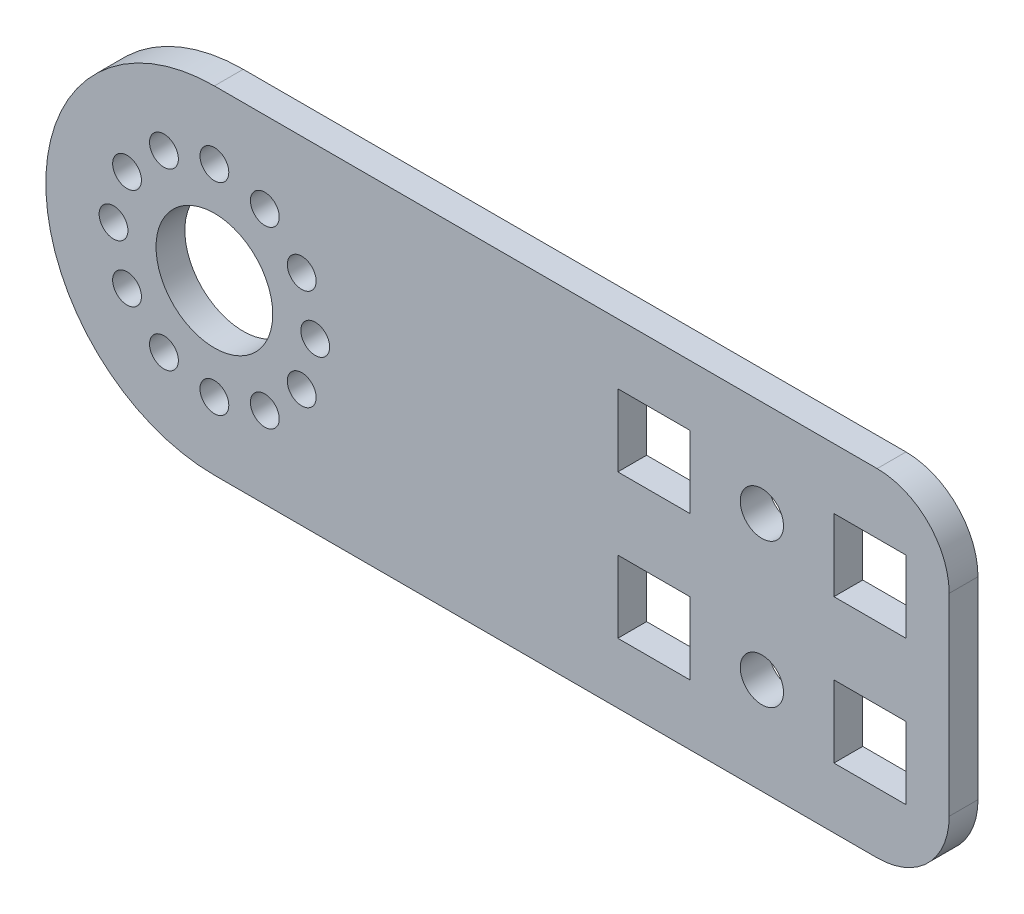
from build123d import *

# Parameters (mm, degrees)
BOSS_EXTRUDE1_OUTLINE_R   = 1
BOSS_EXTRUDE1_OUTLINE_W   = 5
BOSS_EXTRUDE1_OUTLINE_H   = 5
BOSS_EXTRUDE1_OUTLINE_R_2 = 1.5
BOSS_EXTRUDE1_OUTLINE_R_3 = 4.05
BOSS_EXTRUDE1_DEPTH       = 2
CONG_1_R                  = 5


# Read off the part's stored shape, not the designer's step: Boss-Extrude1
with BuildPart() as part:
    # Boss-Extrude1 outline → Boss-Extrude1 (new body)
    with BuildSketch(Plane.XY):
        with BuildLine():
            Line((51, -11.7), (51, 11.7))
            Line((51, 11.7), (0, 11.7))
            ThreePointArc((0, 11.7), (-11.7, 0), (0, -11.7))
            Line((0, -11.7), (51, -11.7))
        make_face()
        with Locations((0, -7)):
            Circle(BOSS_EXTRUDE1_OUTLINE_R, mode=Mode.SUBTRACT)
        with Locations((-3.5, -6.062177826)):
            Circle(BOSS_EXTRUDE1_OUTLINE_R, mode=Mode.SUBTRACT)
        with Locations((3.5, -6.062177826)):
            Circle(BOSS_EXTRUDE1_OUTLINE_R, mode=Mode.SUBTRACT)
        with Locations((-6.062177826, -3.5)):
            Circle(BOSS_EXTRUDE1_OUTLINE_R, mode=Mode.SUBTRACT)
        with Locations((6.062177826, -3.5)):
            Circle(BOSS_EXTRUDE1_OUTLINE_R, mode=Mode.SUBTRACT)
        with Locations((30.5, -5)):
            Rectangle(BOSS_EXTRUDE1_OUTLINE_W, BOSS_EXTRUDE1_OUTLINE_H, mode=Mode.SUBTRACT)
        with Locations((38, -5)):
            Circle(BOSS_EXTRUDE1_OUTLINE_R_2, mode=Mode.SUBTRACT)
        with Locations((45.5, -5)):
            Rectangle(BOSS_EXTRUDE1_OUTLINE_W, BOSS_EXTRUDE1_OUTLINE_H, mode=Mode.SUBTRACT)
        with Locations((-7, 0)):
            Circle(BOSS_EXTRUDE1_OUTLINE_R, mode=Mode.SUBTRACT)
        Circle(BOSS_EXTRUDE1_OUTLINE_R_3, mode=Mode.SUBTRACT)
        with Locations((-6.062177826, 3.5)):
            Circle(BOSS_EXTRUDE1_OUTLINE_R, mode=Mode.SUBTRACT)
        with Locations((7, 0)):
            Circle(BOSS_EXTRUDE1_OUTLINE_R, mode=Mode.SUBTRACT)
        with Locations((6.062177826, 3.5)):
            Circle(BOSS_EXTRUDE1_OUTLINE_R, mode=Mode.SUBTRACT)
        with Locations((-3.5, 6.062177826)):
            Circle(BOSS_EXTRUDE1_OUTLINE_R, mode=Mode.SUBTRACT)
        with Locations((0, 7)):
            Circle(BOSS_EXTRUDE1_OUTLINE_R, mode=Mode.SUBTRACT)
        with Locations((3.5, 6.062177826)):
            Circle(BOSS_EXTRUDE1_OUTLINE_R, mode=Mode.SUBTRACT)
        with Locations((30.5, 5)):
            Rectangle(BOSS_EXTRUDE1_OUTLINE_W, BOSS_EXTRUDE1_OUTLINE_H, mode=Mode.SUBTRACT)
        with Locations((38, 5)):
            Circle(BOSS_EXTRUDE1_OUTLINE_R_2, mode=Mode.SUBTRACT)
        with Locations((45.5, 5)):
            Rectangle(BOSS_EXTRUDE1_OUTLINE_W, BOSS_EXTRUDE1_OUTLINE_H, mode=Mode.SUBTRACT)
    extrude(amount=BOSS_EXTRUDE1_DEPTH)

    # Congé1
    cong_1_edges = [part.edges().sort_by_distance(p)[0] for p in [
        (51, 11.7, 1),
        (51, -11.7, 1),
    ]]
    fillet(cong_1_edges, radius=CONG_1_R)


solid = part.part
